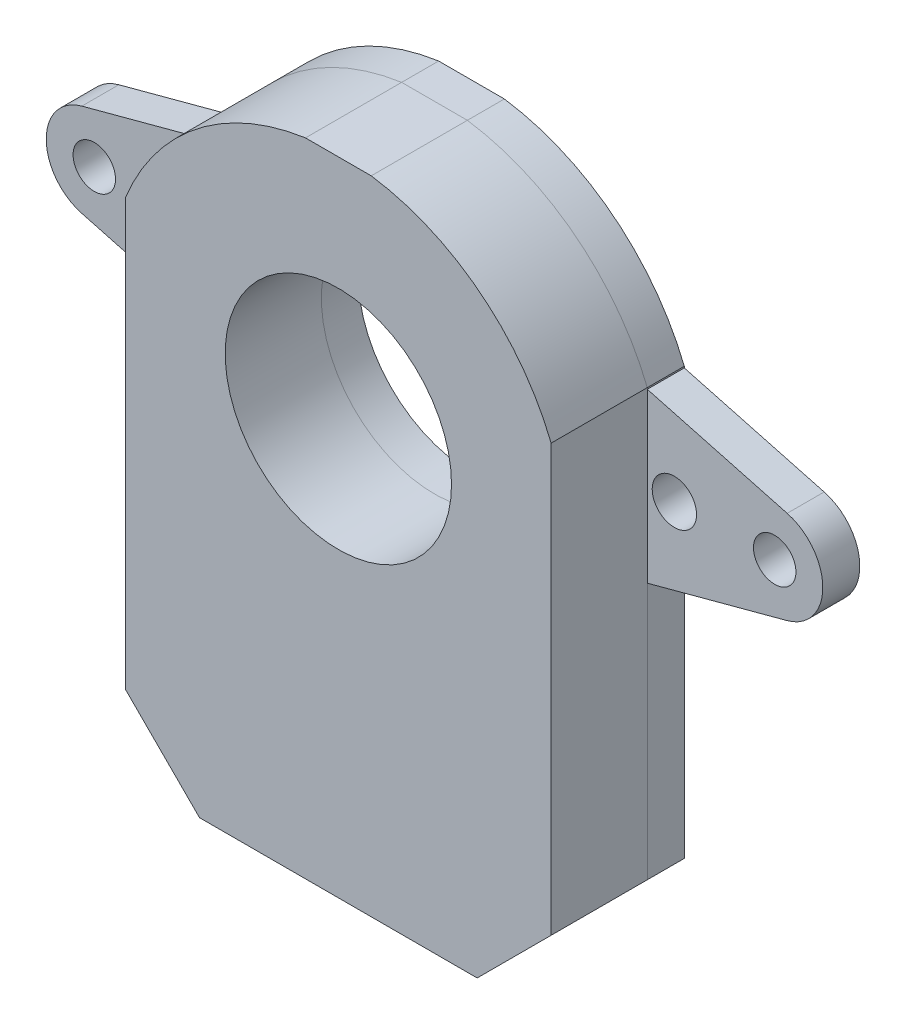
from build123d import *

# Parameters (mm, degrees)
EXTRUDE_1_DEPTH       = 2.5
EXTRUDE_START         = 2.5
EXTRUDE_3_DEPTH       = 6.5
CUT_EXTRUDE_2_DEPTH   = 9
SKETCH_2_R            = 7.65
CUT_EXTRUDE_4_DEPTH   = 33.774530126
EXTRUDE_2_OUTLINE_R   = 1.435
EXTRUDE_2_OUTLINE_R_2 = 1.5
EXTRUDE_2_DEPTH       = 2.5
CHAMFER_1_SIZE        = 5
CHAMFER_2_SIZE        = 5


# Read off the part's stored shape, not the designer's step: Бобышка-Вытянуть2
with BuildPart() as part:
    # Эскиз1 → Бобышка-Вытянуть1 (new body)
    with BuildSketch(Plane.XY):
        Polygon((14.385, 15.34), (0, 15.34), (-14.385, 15.34), (-14.385, -28.04), (14.385, -28.04), align=None)
    extrude(amount=EXTRUDE_1_DEPTH)


with BuildPart() as body_2:
    # Эскиз1<3> → Бобышка-Вытянуть3 (new body)
    with BuildSketch(Plane.XY.offset(EXTRUDE_START)):
        Polygon((14.385, 15.34), (0, 15.34), (-14.385, 15.34), (-14.385, -28.04), (14.385, -28.04), align=None)
    extrude(amount=EXTRUDE_3_DEPTH)


with BuildPart() as cut_extrude_2_tool:
    # Эскиз3 → Вырез-Вытянуть2 (new body)
    with BuildSketch(Plane.XY):
        with BuildLine():
            Line((-14.385, 15.34), (-14.385, 5.772501624))
            ThreePointArc((-14.385, 5.772501624), (-9.582639468, 12.182898703), (-2.22135094, 15.34))
            Line((-2.22135094, 15.34), (-14.385, 15.34))
        make_face()
        with BuildLine():
            Line((14.385, 15.34), (2.22135094, 15.34))
            ThreePointArc((2.22135094, 15.34), (9.582639468, 12.182898703), (14.385, 5.772501624))
            Line((14.385, 5.772501624), (14.385, 15.34))
        make_face()
    extrude(amount=CUT_EXTRUDE_2_DEPTH)


with BuildPart() as part_1:
    add(part.part)

    # Вырез-Вытянуть2: cut by cut_extrude_2_tool
    add(cut_extrude_2_tool.part, mode=Mode.SUBTRACT)


with BuildPart() as body_2_1:
    add(body_2.part)

    # Вырез-Вытянуть2: cut by cut_extrude_2_tool
    add(cut_extrude_2_tool.part, mode=Mode.SUBTRACT)


with BuildPart() as cut_extrude_4_tool:
    # Эскиз2 → Вырез-Вытянуть4 (new, through all)
    with BuildSketch(Plane.XY):
        Circle(SKETCH_2_R)
    extrude(amount=CUT_EXTRUDE_4_DEPTH)


with BuildPart() as part_2:
    add(part_1.part)

    # Вырез-Вытянуть4: cut by cut_extrude_4_tool
    add(cut_extrude_4_tool.part, mode=Mode.SUBTRACT)

    # Бобышка-Вытянуть2 outline → Бобышка-Вытянуть2 (add)
    with BuildSketch(Plane.XY):
        with BuildLine():
            ThreePointArc((-23.83947488, 3.141457498), (-26.25, 0), (-23.83947488, -3.141457498))
            Line((-23.83947488, -3.141457498), (-14.385, -5.674776407))
            Line((-14.385, -5.674776407), (-14.385, 5.674776407))
            Line((-14.385, 5.674776407), (-23.83947488, 3.141457498))
        make_face()
        with Locations((-22.997723881, 0)):
            Circle(EXTRUDE_2_OUTLINE_R, mode=Mode.SUBTRACT)
        with Locations((-16.215, 0)):
            Circle(EXTRUDE_2_OUTLINE_R_2, mode=Mode.SUBTRACT)
    extrude_2 = extrude(amount=EXTRUDE_2_DEPTH)

    # Зеркальное отражение1: Бобышка-Вытянуть2 across plane
    add(extrude_2.mirror(Plane(origin=(0, 0, 0), x_dir=(0, 0, 1), z_dir=(1, 0, 0))))

    # Фаска1
    chamfer_1_edges = [part_2.edges().sort_by_distance(p)[0] for p in [
        (14.385, -28.04, 1.25),
        (-14.385, -28.04, 1.25),
    ]]
    chamfer(chamfer_1_edges, length=CHAMFER_1_SIZE)


with BuildPart() as body_2_2:
    add(body_2_1.part)

    # Вырез-Вытянуть4: cut by cut_extrude_4_tool
    add(cut_extrude_4_tool.part, mode=Mode.SUBTRACT)

    # Фаска2
    chamfer_2_edges = [body_2_2.edges().sort_by_distance(p)[0] for p in [
        (14.385, -28.04, 5.75),
        (-14.385, -28.04, 5.75),
    ]]
    chamfer(chamfer_2_edges, length=CHAMFER_2_SIZE)


solid = Compound([part_2.part, body_2_2.part])
